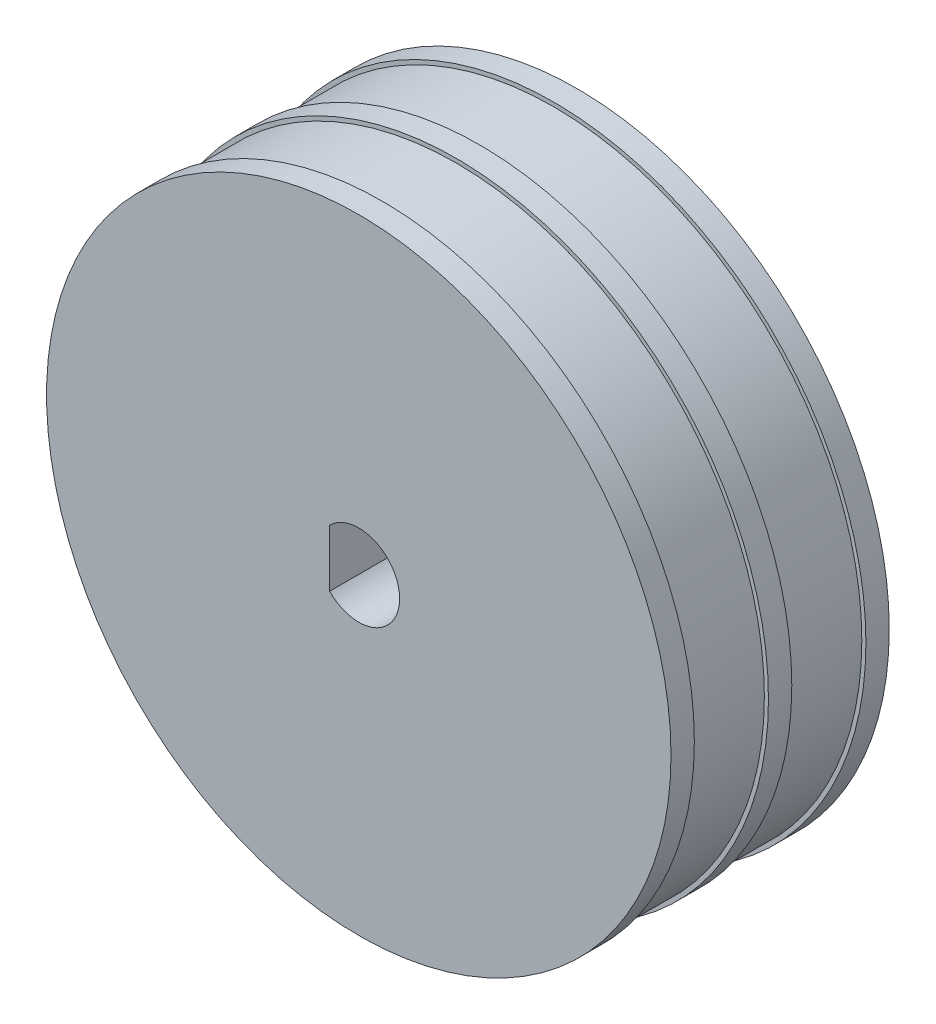
from build123d import *

# Parameters (mm, degrees)
SKETCH2_R           = 13.375
BOSS_EXTRUDE1_DEPTH = 1
SKETCH3_R           = 13.2
BOSS_EXTRUDE2_DEPTH = 3.175
SKETCH4_R           = 13.375
BOSS_EXTRUDE3_DEPTH = 1
SKETCH5_R           = 13.2
BOSS_EXTRUDE4_DEPTH = 3.175
SKETCH6_R           = 13.375
BOSS_EXTRUDE5_DEPTH = 1
CUT_EXTRUDE2_DEPTH  = 22.099851895


with BuildPart() as part:
    # Sketch2 → Boss-Extrude1 (new body)
    with BuildSketch(Plane.XY):
        Circle(SKETCH2_R)
    extrude(amount=BOSS_EXTRUDE1_DEPTH)

    # Sketch3 → Boss-Extrude2 (add)
    with BuildSketch(Plane.XY.offset(1)):
        Circle(SKETCH3_R)
    extrude(amount=BOSS_EXTRUDE2_DEPTH)

    # Sketch4 → Boss-Extrude3 (add)
    with BuildSketch(Plane.XY.offset(4.175)):
        Circle(SKETCH4_R)
    extrude(amount=BOSS_EXTRUDE3_DEPTH)

    # Sketch5 → Boss-Extrude4 (add)
    with BuildSketch(Plane.XY.offset(5.175)):
        Circle(SKETCH5_R)
    extrude(amount=BOSS_EXTRUDE4_DEPTH)

    # Sketch6 → Boss-Extrude5 (add)
    with BuildSketch(Plane.XY.offset(8.35)):
        Circle(SKETCH6_R)
    extrude(amount=BOSS_EXTRUDE5_DEPTH)

    # Sketch8 → Cut-Extrude2 (cut, through all)
    with BuildSketch(Plane(origin=(0, 0, 0), x_dir=(-1, 0, 0), z_dir=(0, 0, -1))):
        with BuildLine():
            Line((1.25, 1.224744871), (1.25, -1.224744871))
            ThreePointArc((1.25, -1.224744871), (-1.75, 0), (1.25, 1.224744871))
        make_face()
    extrude(amount=-CUT_EXTRUDE2_DEPTH, mode=Mode.SUBTRACT)


solid = part.part
